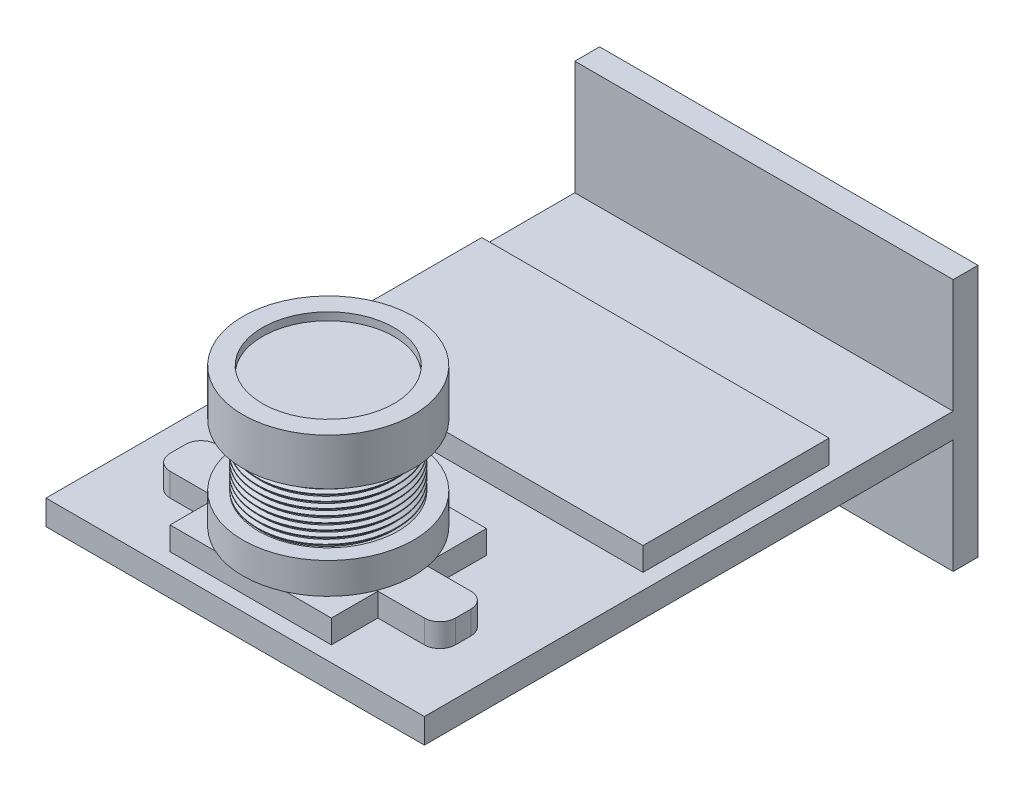
from build123d import *

# Parameters (mm, degrees)
SKETCH1_W           = 24.4
SKETCH1_H           = 1.6
BOSS_EXTRUDE1_DEPTH = 34.1
SKETCH2_W           = 10.4
SKETCH2_H           = 10
BOSS_EXTRUDE2_DEPTH = 1.5
SKETCH3_W           = 18.4
SKETCH3_H           = 3
BOSS_EXTRUDE3_DEPTH = 1.5
FILLET1_R           = 1
SKETCH4_R           = 5.5
BOSS_EXTRUDE4_DEPTH = 2
SKETCH5_R           = 4.5
BOSS_EXTRUDE5_DEPTH = 4
THREAD1_PITCH       = 0.4
SKETCH9_R           = 5.5
BOSS_EXTRUDE6_DEPTH = 3
SKETCH11_R          = 4.246638391
CUT_EXTRUDE1_DEPTH  = 0.5
SKETCH12_W          = 22.4
SKETCH12_H          = 12
BOSS_EXTRUDE7_DEPTH = 1.5
SKETCH13_W          = 20
SKETCH13_H          = 20
BOSS_EXTRUDE8_DEPTH = 1.5
SKETCH14_W          = 24.4
SKETCH14_H          = 16.3
BOSS_EXTRUDE9_DEPTH = 1.6


with BuildPart() as part:
    # Sketch1 → Boss-Extrude1 (new body)
    with BuildSketch(Plane.XY):
        with Locations((-1.963218391, 1.618965517)):
            Rectangle(SKETCH1_W, SKETCH1_H)
    extrude(amount=BOSS_EXTRUDE1_DEPTH)

    # Sketch2 → Boss-Extrude2 (add)
    with BuildSketch(Plane(origin=(0, 2.418965517, 0), x_dir=(1, 0, 0), z_dir=(0, 1, 0))):
        with Locations((-1.963218391, -28.1)):
            Rectangle(SKETCH2_W, SKETCH2_H)
    extrude(amount=BOSS_EXTRUDE2_DEPTH)

    # Sketch3 → Boss-Extrude3 (add)
    with BuildSketch(Plane(origin=(0, 3.918965517, 0), x_dir=(1, 0, 0), z_dir=(0, 1, 0))):
        with Locations((-1.963218391, -28.6)):
            Rectangle(SKETCH3_W, SKETCH3_H)
    extrude(amount=-BOSS_EXTRUDE3_DEPTH)

    # Fillet1
    fillet1_edges = [part.edges().sort_by_distance(p)[0] for p in [
        (7.236781609, 3.168965517, 30.1),
        (-11.163218391, 3.168965517, 27.1),
        (7.236781609, 3.168965517, 27.1),
        (-11.163218391, 3.168965517, 30.1),
    ]]
    fillet(fillet1_edges, radius=FILLET1_R)

    # Sketch4 → Boss-Extrude4 (add)
    with BuildSketch(Plane(origin=(0, 3.918965517, 0), x_dir=(1, 0, 0), z_dir=(0, 1, 0))):
        with Locations(Location((-1.963218391, -28.1, 0), (0, 0, 65.380022671))):
            Circle(SKETCH4_R)
    extrude(amount=BOSS_EXTRUDE4_DEPTH)

    # Sketch5 → Boss-Extrude5 (add)
    with BuildSketch(Plane(origin=(0, 5.918965517, 0), x_dir=(1, 0, 0), z_dir=(0, 1, 0))):
        with Locations(Location((-1.963218391, -28.1, 0), (0, 0, 270))):
            Circle(SKETCH5_R)
    extrude(amount=BOSS_EXTRUDE5_DEPTH)

    # Thread1: the profile of Thread Profile1 profile screwed along a right-hand helix of 10 turns, 6 arcs to a turn; built about Z, then put on its axis
    thread1_z = Axis((0, 0, 0), (0, 0, 1))
    thread1_corners = [(4.5003, 0, -0.000173205), (4.5003, 0, 0.350173204), (4.28349365, 0, 0.224999999), (4.28349365, 0, 0.124999999)]
    with BuildLine(mode=Mode.PRIVATE) as thread1_profile:
        Line(thread1_corners[0], thread1_corners[1])
        Line(thread1_corners[1], thread1_corners[2])
        Line(thread1_corners[2], thread1_corners[3])
        Line(thread1_corners[3], thread1_corners[0])
    thread1_cap = Face(thread1_profile.wire())
    thread1_turn_angles = [0, 30, 60, 90, 120, 150, 180, 210, 240, 270, 300, 330, 360]
    thread1_turn_weights = [1, 0.8660254037844387, 1, 0.8660254037844387, 1, 0.8660254037844387, 1, 0.8660254037844387, 1, 0.8660254037844387, 1, 0.8660254037844387, 1]
    thread1_turn_rails = [Edge.make_bspline([Vector(p[0], p[1], 0).rotate(thread1_z, thread1_turn_angles[k]) / thread1_turn_weights[k] + Vector(0, 0, p[2] + THREAD1_PITCH * thread1_turn_angles[k] / 360) for k in range(13)], [0, 0, 0, 1, 1, 2, 2, 3, 3, 4, 4, 5, 5, 6, 6, 6], 2, thread1_turn_weights) for p in thread1_corners]
    thread1_turn_sides = [Face.make_surface_from_curves(thread1_turn_rails[p[0]], thread1_turn_rails[p[1]]) for p in [(0, 1), (1, 2), (2, 3), (3, 0)]]
    thread1 = Plane(origin=(-1.963218391, 9.918965517, 28.1), x_dir=(-1, 0, 0), z_dir=(0, -1, 0)) * Solid(Shell([*[p.moved(Location((0, 0, THREAD1_PITCH * i))) for i in range(10) for p in thread1_turn_sides], thread1_cap, thread1_cap.rotate(thread1_z, 3600).moved(Location((0, 0, THREAD1_PITCH * 3600 / 360)))]))
    add(thread1, mode=Mode.SUBTRACT)

    # Sketch9 → Boss-Extrude6 (add)
    with BuildSketch(Plane(origin=(0, 9.918965517, 0), x_dir=(1, 0, 0), z_dir=(0, 1, 0))):
        with Locations(Location((-1.963218391, -28.1, 0), (0, 0, 65.380022671))):
            Circle(SKETCH9_R)
    extrude(amount=BOSS_EXTRUDE6_DEPTH)

    # Sketch11 → Cut-Extrude1 (cut)
    with BuildSketch(Plane(origin=(0, 12.918965517, 0), x_dir=(1, 0, 0), z_dir=(0, 1, 0))):
        with Locations(Location((-1.963218391, -28.1, 0), (0, 0, 270))):
            Circle(SKETCH11_R)
    extrude(amount=-CUT_EXTRUDE1_DEPTH, mode=Mode.SUBTRACT)

    # Sketch12 → Boss-Extrude7 (add)
    with BuildSketch(Plane(origin=(0, 2.418965517, 0), x_dir=(1, 0, 0), z_dir=(0, 1, 0))):
        with Locations((-1.963218391, -13)):
            Rectangle(SKETCH12_W, SKETCH12_H)
    extrude(amount=BOSS_EXTRUDE7_DEPTH)

    # Sketch13 → Boss-Extrude8 (add)
    with BuildSketch(Plane.XZ.offset(-0.818965517)):
        with Locations((-1.963218391, 16.1)):
            Rectangle(SKETCH13_W, SKETCH13_H)
    extrude(amount=BOSS_EXTRUDE8_DEPTH)

    # Sketch14 → Boss-Extrude9 (add)
    with BuildSketch(Plane(origin=(0, 0, 0), x_dir=(-1, 0, 0), z_dir=(0, 0, -1))):
        with Locations((1.963218391, 1.618965517)):
            Rectangle(SKETCH14_W, SKETCH14_H)
    extrude(amount=BOSS_EXTRUDE9_DEPTH)


solid = part.part
